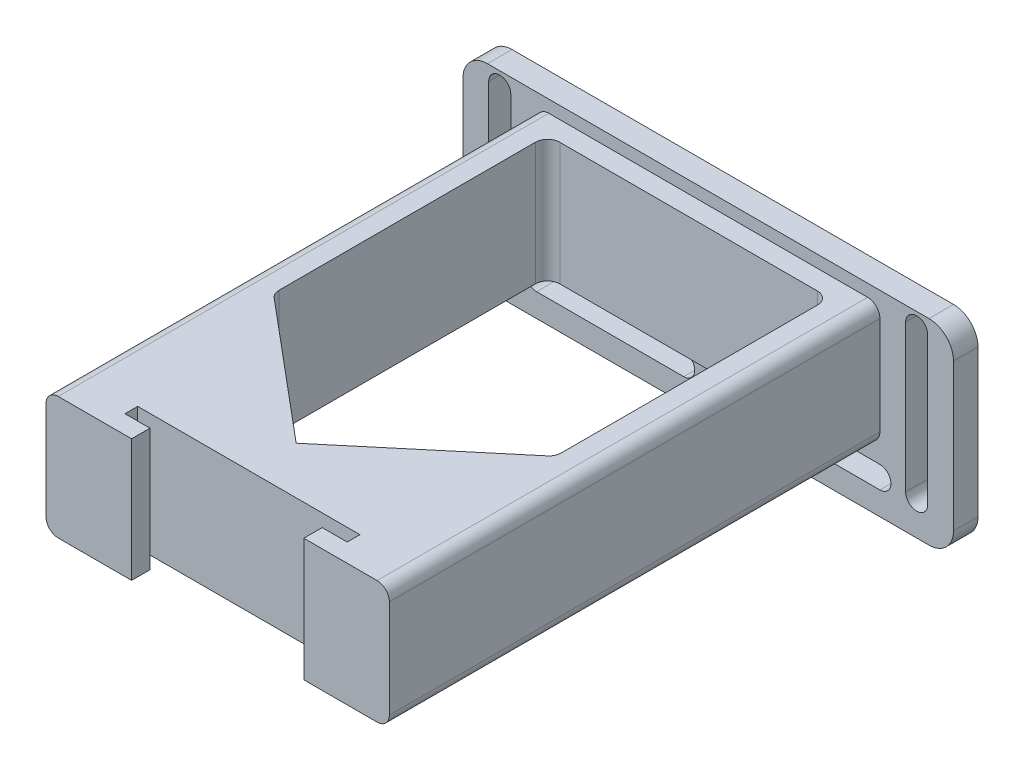
from build123d import *

# Parameters (mm, degrees)
SKETCH1_W           = 100
SKETCH1_H           = 40
BOSS_EXTRUDE1_DEPTH = 5
CUT_EXTRUDE1_DEPTH  = 5
CUT_EXTRUDE2_DEPTH  = 5
CUT_EXTRUDE3_DEPTH  = 5
CUT_EXTRUDE4_DEPTH  = 5
SKETCH3_W           = 70
SKETCH3_H           = 25
BOSS_EXTRUDE2_DEPTH = 100
FILLET1_R           = 5
FILLET2_R           = 2.5
CUT_EXTRUDE8_DEPTH  = 120.504184027
FILLET3_R           = 2.5
CUT_EXTRUDE9_DEPTH  = 120.504184027


with BuildPart() as part:
    # Sketch1 → Boss-Extrude1 (new body)
    with BuildSketch(Plane.XY):
        Rectangle(SKETCH1_W, SKETCH1_H)
    extrude(amount=BOSS_EXTRUDE1_DEPTH)

    # Sketch2 → Cut-Extrude1 (cut)
    with BuildSketch(Plane.XY.offset(5)):
        with BuildLine():
            Line((-40.25, 17), (-40.25, -13))
            ThreePointArc((-40.25, -13), (-42.5, -15.25), (-44.75, -13))
            Line((-44.75, -13), (-44.75, 17))
            ThreePointArc((-44.75, 17), (-42.5, 19.25), (-40.25, 17))
        make_face()
    extrude(amount=-CUT_EXTRUDE1_DEPTH, mode=Mode.SUBTRACT)

    # Sketch2<3> → Cut-Extrude2 (cut)
    with BuildSketch(Plane.XY.offset(5)):
        with BuildLine():
            Line((-35, -10.75), (-5, -10.75))
            ThreePointArc((-5, -10.75), (-2.75, -13), (-5, -15.25))
            Line((-5, -15.25), (-35, -15.25))
            ThreePointArc((-35, -15.25), (-37.25, -13), (-35, -10.75))
        make_face()
    extrude(amount=-CUT_EXTRUDE2_DEPTH, mode=Mode.SUBTRACT)

    # Sketch2<4> → Cut-Extrude3 (cut)
    with BuildSketch(Plane.XY.offset(5)):
        with BuildLine():
            Line((5, -10.75), (35, -10.75))
            ThreePointArc((35, -10.75), (37.25, -13), (35, -15.25))
            Line((35, -15.25), (5, -15.25))
            ThreePointArc((5, -15.25), (2.75, -13), (5, -10.75))
        make_face()
    extrude(amount=-CUT_EXTRUDE3_DEPTH, mode=Mode.SUBTRACT)

    # Sketch2<5> → Cut-Extrude4 (cut)
    with BuildSketch(Plane.XY.offset(5)):
        with BuildLine():
            Line((44.75, 17), (44.75, -13))
            ThreePointArc((44.75, -13), (42.5, -15.25), (40.25, -13))
            Line((40.25, -13), (40.25, 17))
            ThreePointArc((40.25, 17), (42.5, 19.25), (44.75, 17))
        make_face()
    extrude(amount=-CUT_EXTRUDE4_DEPTH, mode=Mode.SUBTRACT)

    # Sketch3 → Boss-Extrude2 (add)
    with BuildSketch(Plane.XY.offset(5)):
        with Locations((0, 5)):
            Rectangle(SKETCH3_W, SKETCH3_H)
    extrude(amount=BOSS_EXTRUDE2_DEPTH)

    # Fillet1
    fillet1_edges = [part.edges().sort_by_distance(p)[0] for p in [
        (-50, 20, 2.5),
        (50, 20, 2.5),
        (50, -20, 2.5),
        (-50, -20, 2.5),
    ]]
    fillet(fillet1_edges, radius=FILLET1_R)

    # Fillet2
    fillet2_edges = [part.edges().sort_by_distance(p)[0] for p in [
        (-35, 17.5, 55),
        (35, 17.5, 55),
        (35, -7.5, 55),
        (-35, -7.5, 55),
    ]]
    fillet(fillet2_edges, radius=FILLET2_R)

    # Sketch8 → Cut-Extrude8 (cut, through all)
    with BuildSketch(Plane.XZ.offset(7.5)):
        Polygon((-28.75, 9), (28.75, 9), (28.75, 64.875885604), (0, 89), (-28.75, 64.875885604), align=None)
    extrude(amount=-CUT_EXTRUDE8_DEPTH, mode=Mode.SUBTRACT)

    # Fillet3
    fillet3_edges = [part.edges().sort_by_distance(p)[0] for p in [
        (28.75, 5, 64.875885604),
        (-28.75, 5, 64.875885604),
        (28.75, 5, 9),
        (-28.75, 5, 9),
    ]]
    fillet(fillet3_edges, radius=FILLET3_R)

    # Sketch5 → Cut-Extrude9 (cut, through all)
    with BuildSketch(Plane.XZ.offset(7.5)):
        Polygon((17.55, 101.25), (22.65, 101.25), (22.65, 98.65), (-22.65, 98.65), (-22.65, 101.25), (-17.55, 101.25), (-17.55, 108.75), (17.55, 108.75), align=None)
    extrude(amount=-CUT_EXTRUDE9_DEPTH, mode=Mode.SUBTRACT)


solid = part.part
